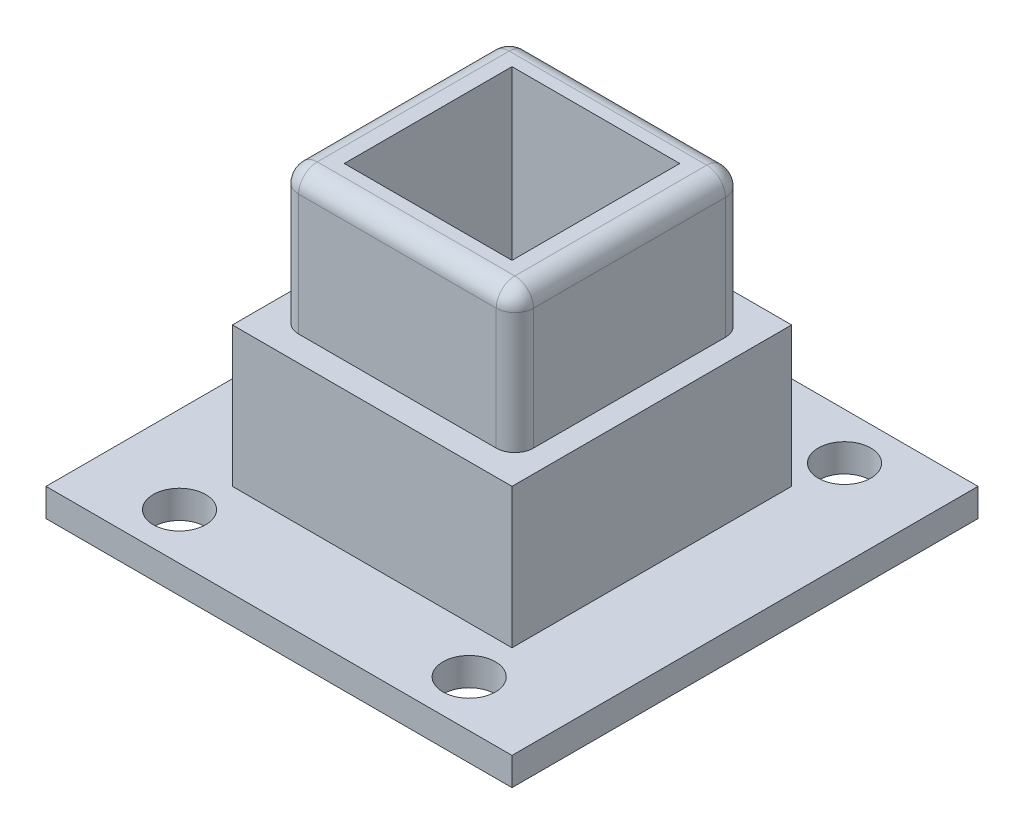
from build123d import *

# Parameters (mm, degrees)
CROQUIS1_W              = 50
CROQUIS1_H              = 50
SALIENTE_EXTRUIR1_DEPTH = 3
CROQUIS2_W              = 30
CROQUIS2_H              = 30
CROQUIS2_W_2            = 18
CROQUIS2_H_2            = 18
SALIENTE_EXTRUIR2_DEPTH = 30
CROQUIS3_R              = 2.813865728
CORTAR_EXTRUIR1_DEPTH   = 10
CROQUIS4_W              = 30
CROQUIS4_H              = 30
CROQUIS4_W_2            = 25.2
CROQUIS4_H_2            = 24.586322286
CORTAR_EXTRUIR2_DEPTH   = 15
REDONDEO1_R             = 2


with BuildPart() as part:
    # Croquis1 → Saliente-Extruir1 (new body)
    with BuildSketch(Plane(origin=(0, 0, 0), x_dir=(1, 0, 0), z_dir=(0, 1, 0))):
        Rectangle(CROQUIS1_W, CROQUIS1_H)
    extrude(amount=SALIENTE_EXTRUIR1_DEPTH)

    # Croquis2 → Saliente-Extruir2 (add)
    with BuildSketch(Plane(origin=(0, 3, 0), x_dir=(1, 0, 0), z_dir=(0, 1, 0))):
        Rectangle(CROQUIS2_W, CROQUIS2_H)
        Rectangle(CROQUIS2_W_2, CROQUIS2_H_2, mode=Mode.SUBTRACT)
    extrude(amount=SALIENTE_EXTRUIR2_DEPTH)

    # Croquis3 → Cortar-Extruir1 (cut)
    with BuildSketch(Plane(origin=(0, 3, 0), x_dir=(1, 0, 0), z_dir=(0, 1, 0))):
        with Locations((15.405421421, -20)):
            Circle(CROQUIS3_R)
        with Locations((-15.676153635, -20)):
            Circle(CROQUIS3_R)
        with Locations((15.676153635, 20)):
            Circle(CROQUIS3_R)
        with Locations((-15.676153635, 20)):
            Circle(CROQUIS3_R)
    extrude(amount=-CORTAR_EXTRUIR1_DEPTH, mode=Mode.SUBTRACT)

    # Croquis4 → Cortar-Extruir2 (cut)
    with BuildSketch(Plane(origin=(0, 33, 0), x_dir=(1, 0, 0), z_dir=(0, 1, 0))):
        Rectangle(CROQUIS4_W, CROQUIS4_H)
        Rectangle(CROQUIS4_W_2, CROQUIS4_H_2, mode=Mode.SUBTRACT)
    extrude(amount=-CORTAR_EXTRUIR2_DEPTH, mode=Mode.SUBTRACT)

    # Redondeo1
    redondeo1_edges = [part.edges().sort_by_distance(p)[0] for p in [
        (0, 33, 12.293161143),
        (-12.6, 25.5, 12.293161143),
        (-12.6, 33, 0),
        (-12.6, 25.5, -12.293161143),
        (0, 33, -12.293161143),
        (12.6, 33, 0),
        (12.6, 25.5, -12.293161143),
        (12.6, 25.5, 12.293161143),
    ]]
    fillet(redondeo1_edges, radius=REDONDEO1_R)


solid = part.part
